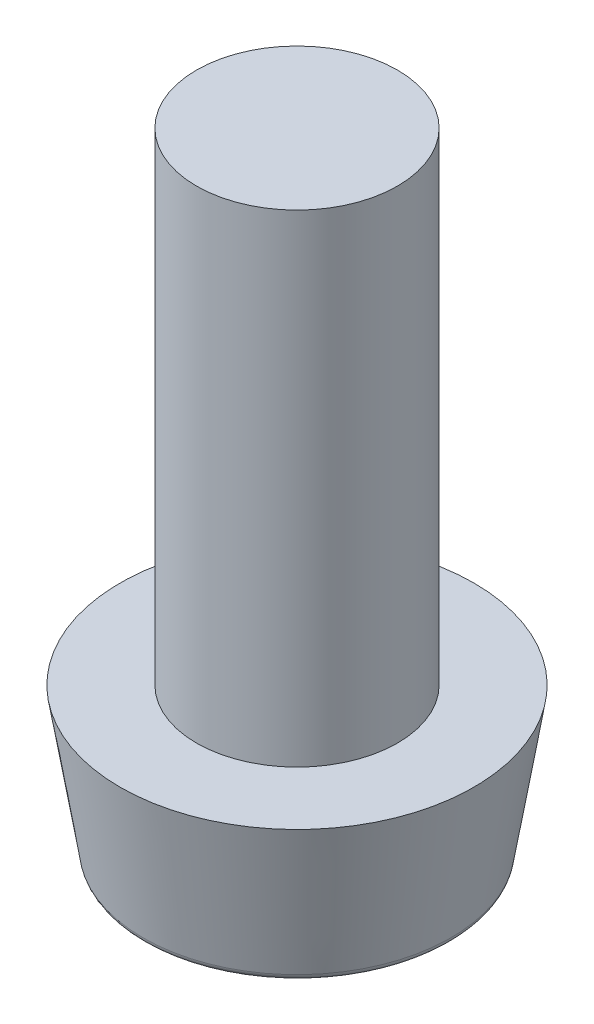
from build123d import *

# Parameters (mm, degrees)
ESQUISSE1_R        = 2.2
BOSS_EXTRU_1_DEPTH = 1.85
ESQUISSE2_R        = 1.25
BOSS_EXTRU_2_DEPTH = 6
CHANFREIN1_SIZE    = 1.85
CHANFREIN1_SIZE_2  = 0.3
CONG_1_R           = 0.1


with BuildPart() as part:
    # Esquisse1 → Boss.-Extru.1 (new body)
    with BuildSketch(Plane(origin=(0, 0, 0), x_dir=(1, 0, 0), z_dir=(0, 1, 0))):
        with Locations(Location((0, 0, 0), (0, 0, 270))):
            Circle(ESQUISSE1_R)
    extrude(amount=BOSS_EXTRU_1_DEPTH)

    # Esquisse2 → Boss.-Extru.2 (add)
    with BuildSketch(Plane(origin=(0, 1.85, 0), x_dir=(1, 0, 0), z_dir=(0, 1, 0))):
        with Locations(Location((0, 0, 0), (0, 0, 270))):
            Circle(ESQUISSE2_R)
    extrude(amount=BOSS_EXTRU_2_DEPTH)

    # Chanfrein1
    # the kernel refuses this chamfer: 1.85, 0.3 mm, written as the material it takes off along each edge
    with BuildSketch(Plane(origin=(0, 0, 0), x_dir=(0, 0, 1), z_dir=(-1, 0, 0))) as chanfrein1_piece_1:
        Polygon((2.2, CHANFREIN1_SIZE), (2.2 - CHANFREIN1_SIZE_2, 0), (2.2, 0), align=None)
    revolve(axis=Axis((0, 0, 0), (0, 1, 0)), mode=Mode.SUBTRACT)

    # Congé1
    cong_1_edges = [part.edges().sort_by_distance(p)[0] for p in [
        (0, 0, -1.9),
    ]]
    fillet(cong_1_edges, radius=CONG_1_R)


solid = part.part
